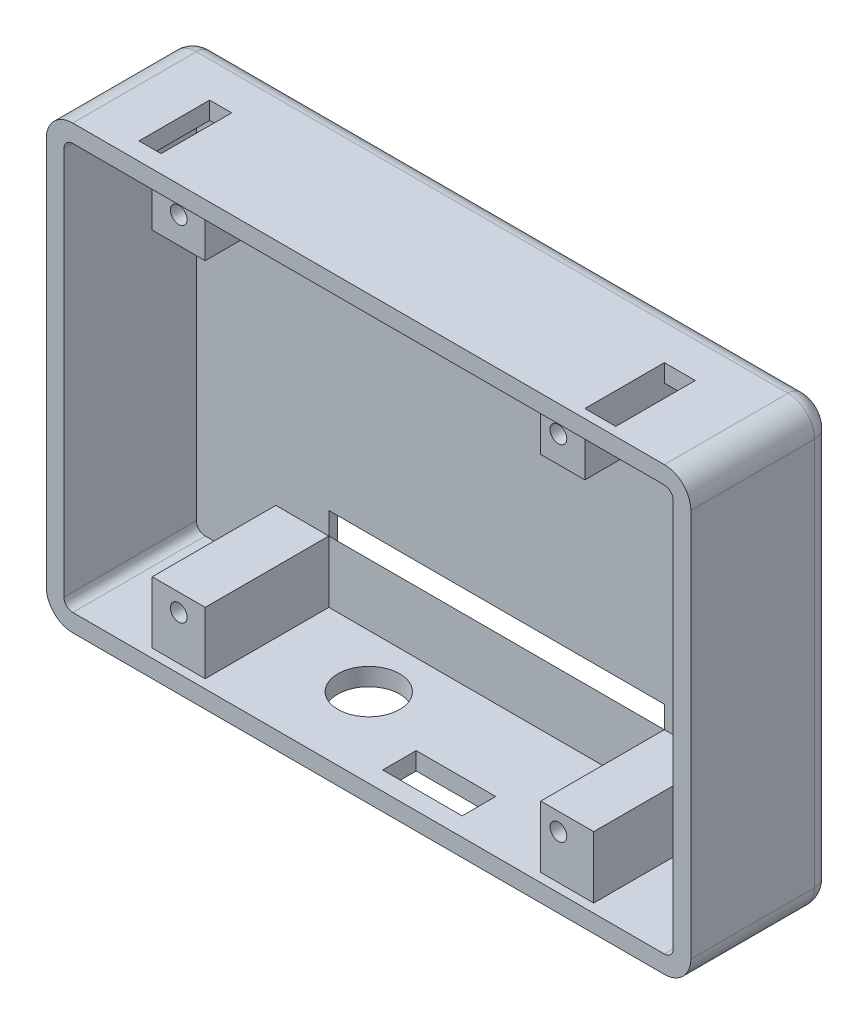
from build123d import *

# Parameters (mm, degrees)
SKETCH1_W           = 73
SKETCH1_H           = 50
BOSS_EXTRUDE1_DEPTH = 1
SKETCH2_W           = 73
SKETCH2_H           = 50
SKETCH2_W_2         = 69
SKETCH2_H_2         = 46
BOSS_EXTRUDE2_DEPTH = 15
FILLET1_R           = 3
FILLET2_R           = 1
SKETCH3_W           = 9
SKETCH3_H           = 3.8
CUT_EXTRUDE1_DEPTH  = 2
SKETCH5_R           = 3.5
CUT_EXTRUDE2_DEPTH  = 2
SKETCH6_W           = 6
SKETCH6_H           = 5
SKETCH6_W_2         = 5
BOSS_EXTRUDE3_DEPTH = 14
SKETCH7_W           = 6
SKETCH7_H           = 7
BOSS_EXTRUDE4_DEPTH = 14
FILLET3_R           = 2
SKETCH8_W           = 2.5
SKETCH8_H           = 7.999199493
SKETCH8_W_2         = 3.5
SKETCH8_H_2         = 9
CUT_EXTRUDE3_DEPTH  = 63.387899545
SKETCH9_R           = 0.95
CUT_EXTRUDE4_DEPTH  = 47.714558812
SKETCH10_W          = 38
SKETCH10_H          = 1.5
CUT_EXTRUDE5_DEPTH  = 47.714558812
CHAMFER1_SIZE       = 1
CHAMFER2_SIZE       = 1


with BuildPart() as part:
    # Sketch1 → Boss-Extrude1 (new body)
    with BuildSketch(Plane.XY):
        Rectangle(SKETCH1_W, SKETCH1_H)
    extrude(amount=BOSS_EXTRUDE1_DEPTH)

    # Sketch2 → Boss-Extrude2 (add)
    with BuildSketch(Plane.XY.offset(1)):
        Rectangle(SKETCH2_W, SKETCH2_H)
        Rectangle(SKETCH2_W_2, SKETCH2_H_2, mode=Mode.SUBTRACT)
    extrude(amount=BOSS_EXTRUDE2_DEPTH)

    # Fillet1
    fillet1_edges = [part.edges().sort_by_distance(p)[0] for p in [
        (36.5, -25, 8),
        (-36.5, -25, 8),
        (-36.5, 25, 8),
        (36.5, 25, 8),
    ]]
    fillet(fillet1_edges, radius=FILLET1_R)

    # Fillet2
    fillet2_edges = [part.edges().sort_by_distance(p)[0] for p in [
        (34.5, 23, 8.5),
        (-34.5, 23, 8.5),
        (-34.5, -23, 8.5),
        (34.5, -23, 8.5),
    ]]
    fillet(fillet2_edges, radius=FILLET2_R)

    # Sketch3 → Cut-Extrude1 (cut)
    with BuildSketch(Plane.XZ.offset(25)):
        with Locations((4, 12)):
            Rectangle(SKETCH3_W, SKETCH3_H)
    extrude(amount=-CUT_EXTRUDE1_DEPTH, mode=Mode.SUBTRACT)

    # Sketch5 → Cut-Extrude2 (cut)
    with BuildSketch(Plane(origin=(0, -23, 0), x_dir=(1, 0, 0), z_dir=(0, 1, 0))):
        with Locations(Location((-8.976447348, -7, 0), (0, 0, 270))):
            Circle(SKETCH5_R)
    extrude(amount=-CUT_EXTRUDE2_DEPTH, mode=Mode.SUBTRACT)

    # Sketch6 → Boss-Extrude3 (add)
    with BuildSketch(Plane.XY.offset(1)):
        with Locations((-22.5, 20.5)):
            Rectangle(SKETCH6_W, SKETCH6_H)
        with Locations((21, 20.5)):
            Rectangle(SKETCH6_W_2, SKETCH6_H)
    extrude(amount=BOSS_EXTRUDE3_DEPTH)

    # Sketch7 → Boss-Extrude4 (add)
    with BuildSketch(Plane.XY.offset(1)):
        with Locations((21.5, -19.5)):
            Rectangle(SKETCH7_W, SKETCH7_H)
        with Locations((-22.5, -19.5)):
            Rectangle(SKETCH7_W, SKETCH7_H)
    extrude(amount=BOSS_EXTRUDE4_DEPTH)

    # Fillet3
    fillet3_edges = [part.edges().sort_by_distance(p)[0] for p in [
        (-36.5, 0, 0),
        (36.5, 0, 0),
        (0, -25, 0),
        (0, 25, 0),
        (35.621320344, -24.121320344, 0),
        (35.621320344, 24.121320344, 0),
        (-35.621320344, -24.121320344, 0),
        (-35.621320344, 24.121320344, 0),
    ]]
    fillet(fillet3_edges, radius=FILLET3_R)

    # Sketch8 → Cut-Extrude3 (cut, through all)
    with BuildSketch(Plane.XZ.offset(-23)):
        with Locations((-26.75, 9.999599746)):
            Rectangle(SKETCH8_W, SKETCH8_H)
        with Locations((25.25, 10.5)):
            Rectangle(SKETCH8_W_2, SKETCH8_H_2)
    extrude(amount=-CUT_EXTRUDE3_DEPTH, mode=Mode.SUBTRACT)

    # Sketch9 → Cut-Extrude4 (cut, through all)
    with BuildSketch(Plane.XY.offset(15)):
        with Locations((-22.5, 21)):
            Circle(SKETCH9_R)
        with Locations((20.5, 21)):
            Circle(SKETCH9_R)
        with Locations((20.5, -18)):
            Circle(SKETCH9_R)
        with Locations((-22.5, -18)):
            Circle(SKETCH9_R)
    extrude(amount=-CUT_EXTRUDE4_DEPTH, mode=Mode.SUBTRACT)

    # Sketch10 → Cut-Extrude5 (cut, through all)
    with BuildSketch(Plane.XY.offset(1)):
        with Locations((-0.5, 17.25)):
            Rectangle(SKETCH10_W, SKETCH10_H)
        with Locations((-0.5, -15.25)):
            Rectangle(SKETCH10_W, SKETCH10_H)
    extrude(amount=-CUT_EXTRUDE5_DEPTH, mode=Mode.SUBTRACT)

    # Chamfer1
    chamfer1_edges = [part.edges().sort_by_distance(p)[0] for p in [
        (-0.5, -16, 0),
        (-0.5, 18, 0),
    ]]
    chamfer(chamfer1_edges, length=CHAMFER1_SIZE - 0.0001)  # a hair under: the kernel refuses the full size

    # Chamfer2
    chamfer2_edges = [part.edges().sort_by_distance(p)[0] for p in [
        (-0.5, 16.5, 1),
        (-0.5, -14.5, 1),
    ]]
    chamfer(chamfer2_edges, length=CHAMFER2_SIZE - 0.0001)  # a hair under: the kernel refuses the full size


solid = part.part
